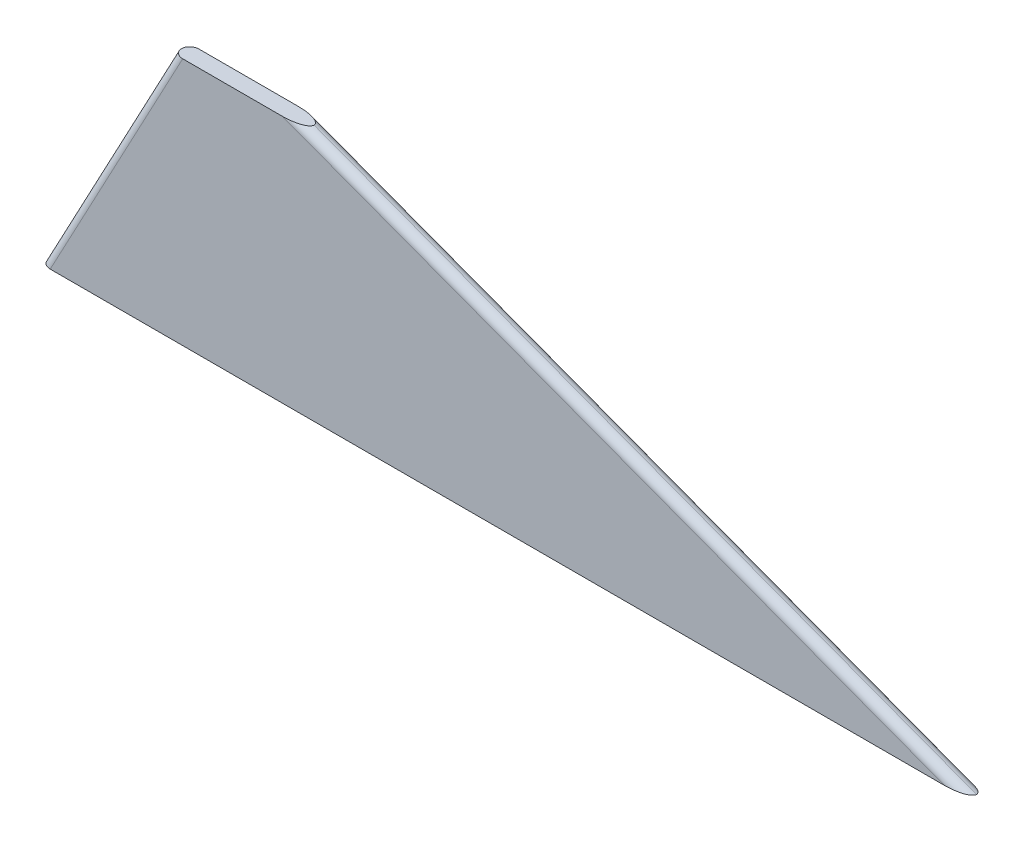
from build123d import *

# Parameters (mm, degrees)
BOSS_EXTRUDE1_DEPTH = 6.35
FILLET1_R           = 3.175


with BuildPart() as part:
    # Sketch1 → Boss-Extrude1 (new body)
    with BuildSketch(Plane.XY):
        Polygon((0, 0), (-355.6, 0), (-304.8, 95.25), (-254, 95.25), align=None)
    extrude(amount=BOSS_EXTRUDE1_DEPTH)

    # Fillet1
    fillet1_edges = [part.edges().sort_by_distance(p)[0] for p in [
        (-330.2, 47.625, 6.35),
        (-330.2, 47.625, 0),
        (-127, 47.625, 6.35),
        (-127, 47.625, 0),
    ]]
    fillet(fillet1_edges, radius=FILLET1_R - 0.0001)  # a hair under: the kernel refuses the full size


solid = part.part
